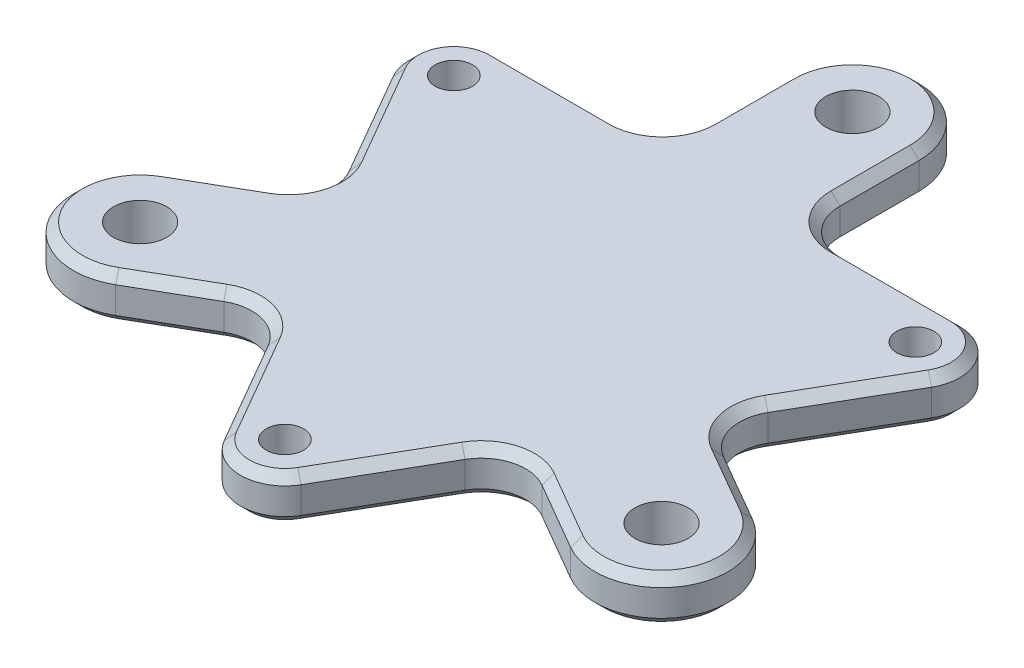
from build123d import *

# Parameters (mm, degrees)
EXTRUDE_2_OUTLINE_R   = 3
EXTRUDE_2_OUTLINE_R_2 = 2.1
EXTRUDE_2_DEPTH       = 5
FILLET_1_R            = 5
CHAMFER_1_SIZE        = 1
CHAMFER_2_SIZE        = 1


# Read off the part's stored shape, not the designer's step: ﾎﾞｽ - 押し出し2
with BuildPart() as part:
    # ﾎﾞｽ - 押し出し2 outline → ﾎﾞｽ - 押し出し2 (new body)
    with BuildSketch(Plane(origin=(0, 0, 0), x_dir=(1, 0, 0), z_dir=(0, 1, 0))):
        with BuildLine():
            Line((-25.627313747, -23.456190528), (-13.58012702, -16.500744028))
            Line((-13.58012702, -16.500744028), (-4.330127019, -32.522214))
            ThreePointArc((-4.330127019, -32.522214), (0, -35.022214), (4.330127019, -32.522214))
            Line((4.330127019, -32.522214), (13.595203608, -16.474630613))
            Line((13.595203608, -16.474630613), (25.627663459, -23.456392422))
            ThreePointArc((25.627663459, -23.456392422), (35.872706169, -20.710650288), (33.126964036, -10.465607578))
            Line((33.126964036, -10.465607578), (21.079752539, -3.511011592))
            Line((21.079752539, -3.511011592), (30.330127021, 12.511107))
            ThreePointArc((30.330127021, 12.511107), (30.330127021, 17.511107), (26.000000002, 20.011107))
            Line((26.000000002, 20.011107), (7.500451194, 20.011107))
            Line((7.500451194, 20.011107), (7.500451194, 33.922))
            ThreePointArc((7.500451194, 33.922), (0, 41.422451194), (-7.500451194, 33.922))
            Line((-7.500451194, 33.922), (-7.500451194, 20.011107))
            Line((-7.500451194, 20.011107), (-26.000000002, 20.011107))
            ThreePointArc((-26.000000002, 20.011107), (-30.330127021, 17.511107), (-30.330127021, 12.511107))
            Line((-30.330127021, 12.511107), (-21.08012702, -3.510362972))
            Line((-21.08012702, -3.510362972), (-33.127313747, -10.465809472))
            ThreePointArc((-33.127313747, -10.465809472), (-35.872504276, -20.711), (-25.627313747, -23.456190528))
        make_face()
        with Locations((-29.377313747, -16.961)):
            Circle(EXTRUDE_2_OUTLINE_R, mode=Mode.SUBTRACT)
        with Locations((0, -30.022214)):
            Circle(EXTRUDE_2_OUTLINE_R_2, mode=Mode.SUBTRACT)
        with Locations((29.377313747, -16.961)):
            Circle(EXTRUDE_2_OUTLINE_R, mode=Mode.SUBTRACT)
        with Locations((-26.000000002, 15.011107)):
            Circle(EXTRUDE_2_OUTLINE_R_2, mode=Mode.SUBTRACT)
        with Locations((26.000000002, 15.011107)):
            Circle(EXTRUDE_2_OUTLINE_R_2, mode=Mode.SUBTRACT)
        with Locations((0, 33.922)):
            Circle(EXTRUDE_2_OUTLINE_R, mode=Mode.SUBTRACT)
    extrude(amount=EXTRUDE_2_DEPTH)

    # ﾌｨﾚｯﾄ1
    fillet_1_edges = [part.edges().sort_by_distance(p)[0] for p in [
        (-13.58012702, 2.5, 16.500744028),
        (-21.08012702, 2.5, 3.510362972),
        (-7.500451194, 2.5, -20.011107),
        (7.500451194, 2.5, -20.011107),
        (21.079752539, 2.5, 3.511011592),
        (13.595203608, 2.5, 16.474630613),
    ]]
    fillet(fillet_1_edges, radius=FILLET_1_R)

    # 面取り1
    chamfer_1_edges = [part.edges().sort_by_distance(p)[0] for p in [
        (-14.116158813, 0, 18.501241916),
        (-21.768783893, 0, 21.228467278),
        (-35.872504276, 0, 20.711),
        (-29.268783893, 0, 8.238086222),
        (-30.330127021, 0, -17.511107),
        (-19.250225598, 0, -20.011107),
        (-7.500451194, 0, -29.4665535),
        (0, 0, -41.422451194),
        (7.500451194, 0, -29.4665535),
        (30.330127021, 0, -17.511107),
        (26.955007083, 0, -6.665227785),
        (29.26860567, 0, 8.238260311),
        (35.872706169, 0, 20.710650288),
        (21.778474587, 0, 21.222923938),
        (0, 0, 35.022214),
        (-7.705127019, 0, 26.676542524),
        (7.709952964, 0, 26.668183744),
        (19.250225598, 0, -20.011107),
        (-26.95512702, 0, -6.665435523),
        (14.131045637, 0, 18.483124699),
        (23.080419871, 0, 2.97487667),
        (8.964917288, 0, -21.475573094),
        (-8.964917288, 0, -21.475573094),
        (-23.080624907, 0, 2.974331179),
    ]]
    chamfer(chamfer_1_edges, length=CHAMFER_1_SIZE)

    # 面取り2
    chamfer_2_edges = [part.edges().sort_by_distance(p)[0] for p in [
        (-7.705127019, 5, 26.676542524),
        (-23.080624907, 5, 2.974331179),
        (-14.116158813, 5, 18.501241916),
        (0, 5, 35.022214),
        (21.778474587, 5, 21.222923938),
        (35.872706169, 5, 20.710650288),
        (29.26860567, 5, 8.238260311),
        (26.955007083, 5, -6.665227785),
        (30.330127021, 5, -17.511107),
        (7.500451194, 5, -29.4665535),
        (0, 5, -41.422451194),
        (-7.500451194, 5, -29.4665535),
        (-19.250225598, 5, -20.011107),
        (-30.330127021, 5, -17.511107),
        (-29.268783893, 5, 8.238086222),
        (-35.872504276, 5, 20.711),
        (7.709952964, 5, 26.668183744),
        (-21.768783893, 5, 21.228467278),
        (19.250225598, 5, -20.011107),
        (-26.95512702, 5, -6.665435523),
        (14.131045637, 5, 18.483124699),
        (23.080419871, 5, 2.97487667),
        (8.964917288, 5, -21.475573094),
        (-8.964917288, 5, -21.475573094),
    ]]
    chamfer(chamfer_2_edges, length=CHAMFER_2_SIZE)


solid = part.part
